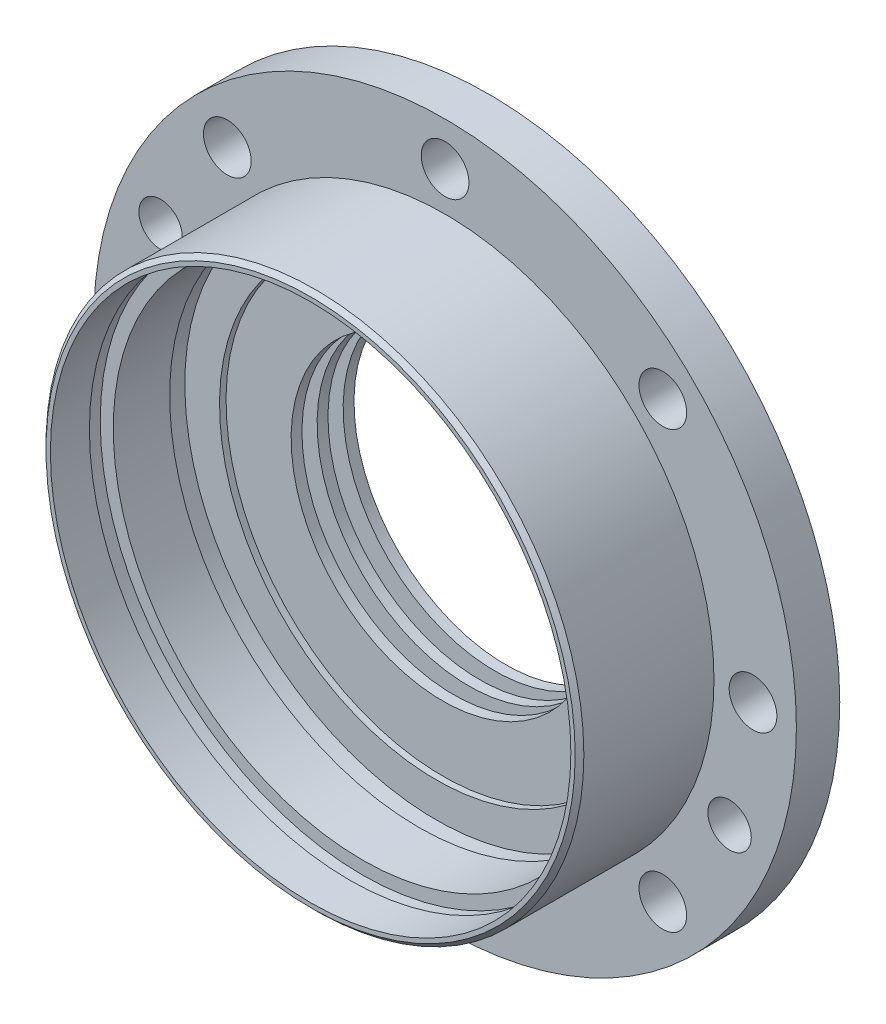
from build123d import *

# Parameters (mm, degrees)
SKETCH_1_R               = 55
EXTRUDE_1_DEPTH          = 4
SKETCH_2_R               = 81
EXTRUDE_2_DEPTH          = 10
EXTRUDE_START            = 14
SKETCH_3_R               = 62
EXTRUDE_3_DEPTH          = 31
HOLE_WIZARD_1_D          = 11
PATTERN_CIRCULAR_1_COUNT = 8
HOLE_START               = 4
HOLE_WIZARD_2_OUTLINE_R  = 5
HOLE_WIZARD_2_DEPTH      = 10
CHAMFER_1_SIZE           = 1


# Read off the part's stored shape, not the designer's step: 孔2
with BuildPart() as part:
    # 草图1 → 凸台-拉伸1 (new body)
    with BuildSketch(Plane.XY):
        Circle(SKETCH_1_R)
    extrude(amount=EXTRUDE_1_DEPTH)

    # 草图2 → 凸台-拉伸2 (add)
    with BuildSketch(Plane.XY.offset(4)):
        Circle(SKETCH_2_R)
    extrude(amount=EXTRUDE_2_DEPTH)

    # 草图3 → 凸台-拉伸3 (add)
    with BuildSketch(Plane.XY.offset(EXTRUDE_START)):
        Circle(SKETCH_3_R)
    extrude(amount=EXTRUDE_3_DEPTH)

    # 草图4 → 切除-旋转1 (revolve, cut)
    with BuildSketch(Plane(origin=(0, 0, 0), x_dir=(0, 0, -1), z_dir=(1, 0, 0)), mode=Mode.PRIVATE) as cut_revolve_1_sk:
        Polygon((-45, 0), (-45, -60), (-36, -60), (-36, -60.5), (-33, -60.5), (-33, -57.5), (-20, -57.5), (-20, -58), (-16, -58), (-16, -50), (-14.5, -50), (-14.5, -35), (-12, -35), (-12, -40.6), (-8.5, -40.6), (-8.5, -35), (-6, -35), (-6, -40.6), (-2.5, -40.6), (-2.5, -35), (0, -35), (0, 0), align=None)
    revolve(cut_revolve_1_sk.sketch.rotate(Axis((0, 0, -13.139169211), (0, 0, 1)), 180), axis=Axis((0, 0, -13.139169211), (0, 0, 1)), mode=Mode.SUBTRACT)

    # 孔1 (through all)
    with Locations(Plane.XY.offset(14)):
        with Locations((-71, 0)):
            hole_wizard_1 = Hole(HOLE_WIZARD_1_D / 2)

    # 阵列(圆周)1: 孔1 ×8 about axis
    pattern_circular_1_axis = Axis((0, 0, 0), (0, 0, 1))
    for i in range(1, PATTERN_CIRCULAR_1_COUNT):
        add(hole_wizard_1.rotate(pattern_circular_1_axis, i * 360 / PATTERN_CIRCULAR_1_COUNT), mode=Mode.SUBTRACT)

    # 孔2 outline → 孔2 (cut)
    with BuildSketch(Plane.XY.offset(HOLE_START)):
        with Locations((-65.595446808, 27.170523698)):
            Circle(HOLE_WIZARD_2_OUTLINE_R)
        with Locations((65.595446808, -27.170523698)):
            Circle(HOLE_WIZARD_2_OUTLINE_R)
    extrude(amount=HOLE_WIZARD_2_DEPTH, mode=Mode.SUBTRACT)

    # 倒角1
    chamfer_1_edges = [part.edges().sort_by_distance(p)[0] for p in [
        (-62, 0, 45),
    ]]
    chamfer(chamfer_1_edges, length=CHAMFER_1_SIZE)


solid = part.part
